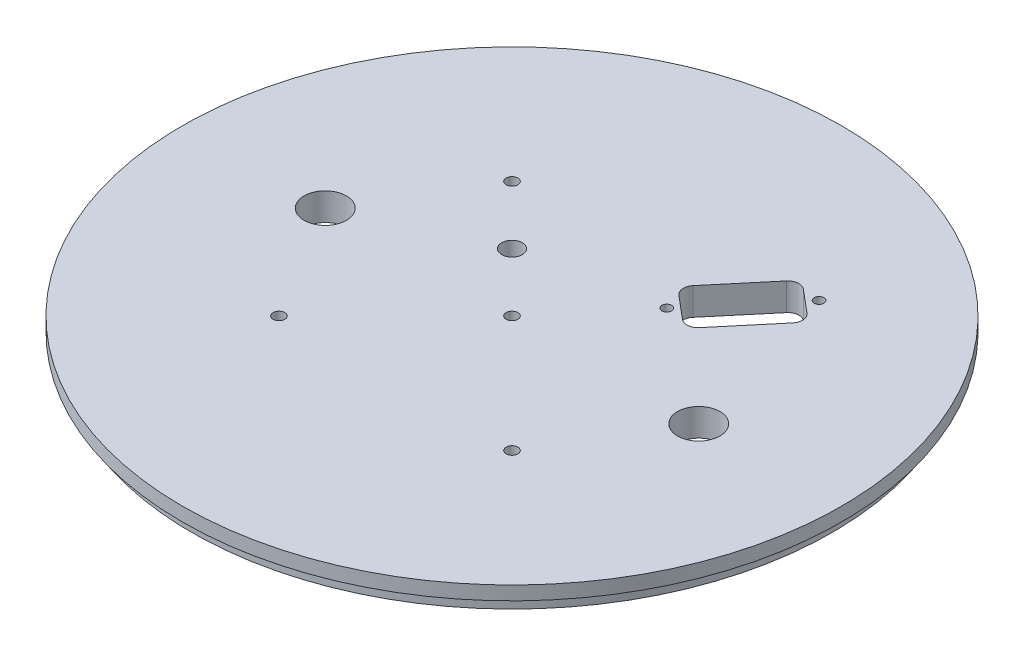
from build123d import *

# Parameters (mm, degrees)
SKETCH1_R                 = 76.2
SKETCH1_R_2               = 4.9022
SKETCH1_R_3               = 1.3589
SKETCH1_R_4               = 2.38125
BOSS_EXTRUDE1_DEPTH       = 6.35
SKETCH2_R                 = 76.2
SKETCH2_R_2               = 74.041
CUT_EXTRUDE1_DEPTH        = 3.175
CUT_EXTRUDE2_START        = -3.175
CUT_EXTRUDE2_DEPTH        = 3.556
TAP_DRILL_FOR_4_40_TAP1_D = 2.2606
CUT_EXTRUDE3_DEPTH        = 108.95


with BuildPart() as part:
    # Sketch1 → Boss-Extrude1 (new body)
    with BuildSketch(Plane(origin=(0, 0, 0), x_dir=(1, 0, 0), z_dir=(0, 1, 0))):
        Circle(SKETCH1_R)
        with Locations((43.18, 0)):
            Circle(SKETCH1_R_2, mode=Mode.SUBTRACT)
        with Locations((-43.18, 0)):
            Circle(SKETCH1_R_2, mode=Mode.SUBTRACT)
        with Locations((-26.940768363, 26.940768363)):
            Circle(SKETCH1_R_3, mode=Mode.SUBTRACT)
        with Locations((26.940768363, -26.940768363)):
            Circle(SKETCH1_R_3, mode=Mode.SUBTRACT)
        with Locations((-13.470384182, 13.470384182)):
            Circle(SKETCH1_R_4, mode=Mode.SUBTRACT)
        with Locations((-26.940768363, -26.940768363)):
            Circle(SKETCH1_R_3, mode=Mode.SUBTRACT)
        Circle(SKETCH1_R_3, mode=Mode.SUBTRACT)
    extrude(amount=BOSS_EXTRUDE1_DEPTH)

    # Sketch2 → Cut-Extrude1 (cut)
    with BuildSketch(Plane.XZ):
        Circle(SKETCH2_R)
        Circle(SKETCH2_R_2, mode=Mode.SUBTRACT)
    extrude(amount=-CUT_EXTRUDE1_DEPTH, mode=Mode.SUBTRACT)

    # Sketch3 → Cut-Extrude2 (cut)
    with BuildSketch(Plane(origin=(0, 6.35, 0), x_dir=(1, 0, 0), z_dir=(0, 1, 0)).offset(CUT_EXTRUDE2_START)):
        with BuildLine():
            Line((3.2385, 34.798), (3.2385, 13.97))
            ThreePointArc((3.2385, 13.97), (0, 10.7315), (-3.2385, 13.97))
            Line((-3.2385, 13.97), (-3.2385, 34.798))
            ThreePointArc((-3.2385, 34.798), (0, 38.0365), (3.2385, 34.798))
        make_face()
        with BuildLine():
            Line((3.2385, -34.798), (3.2385, -13.97))
            ThreePointArc((3.2385, -13.97), (0, -10.7315), (-3.2385, -13.97))
            Line((-3.2385, -13.97), (-3.2385, -34.798))
            ThreePointArc((-3.2385, -34.798), (0, -38.0365), (3.2385, -34.798))
        make_face()
    extrude(amount=-CUT_EXTRUDE2_DEPTH, mode=Mode.SUBTRACT)

    # Tap Drill for #4-40 Tap1 (through all)
    with Locations(Plane(origin=(0, 6.35, 0), x_dir=(1, 0, 0), z_dir=(0, 1, 0))):
        with Locations((16.326805286, 19.457528855), (32.396495553, 38.608639962)):
            Hole(TAP_DRILL_FOR_4_40_TAP1_D / 2)

    # Sketch4 → Cut-Extrude3 (cut, through all)
    with BuildSketch(Plane(origin=(0, 6.35, 0), x_dir=(1, 0, 0), z_dir=(0, 1, 0))):
        with BuildLine():
            Line((15.169451366, 23.412825166), (20.422984157, 19.004587739))
            ThreePointArc((20.422984157, 19.004587739), (22.277040272, 18.420006091), (24.001417571, 19.317660095))
            Line((24.001417571, 19.317660095), (33.866921829, 31.074910238))
            ThreePointArc((33.866921829, 31.074910238), (34.451503477, 32.928966353), (33.553849472, 34.653343652))
            Line((33.553849472, 34.653343652), (28.300316681, 39.061581079))
            ThreePointArc((28.300316681, 39.061581079), (26.446260566, 39.646162727), (24.721883267, 38.748508722))
            Line((24.721883267, 38.748508722), (14.856379009, 26.99125858))
            ThreePointArc((14.856379009, 26.99125858), (14.271797362, 25.137202465), (15.169451366, 23.412825166))
        make_face()
    extrude(amount=-CUT_EXTRUDE3_DEPTH, mode=Mode.SUBTRACT)


solid = part.part
